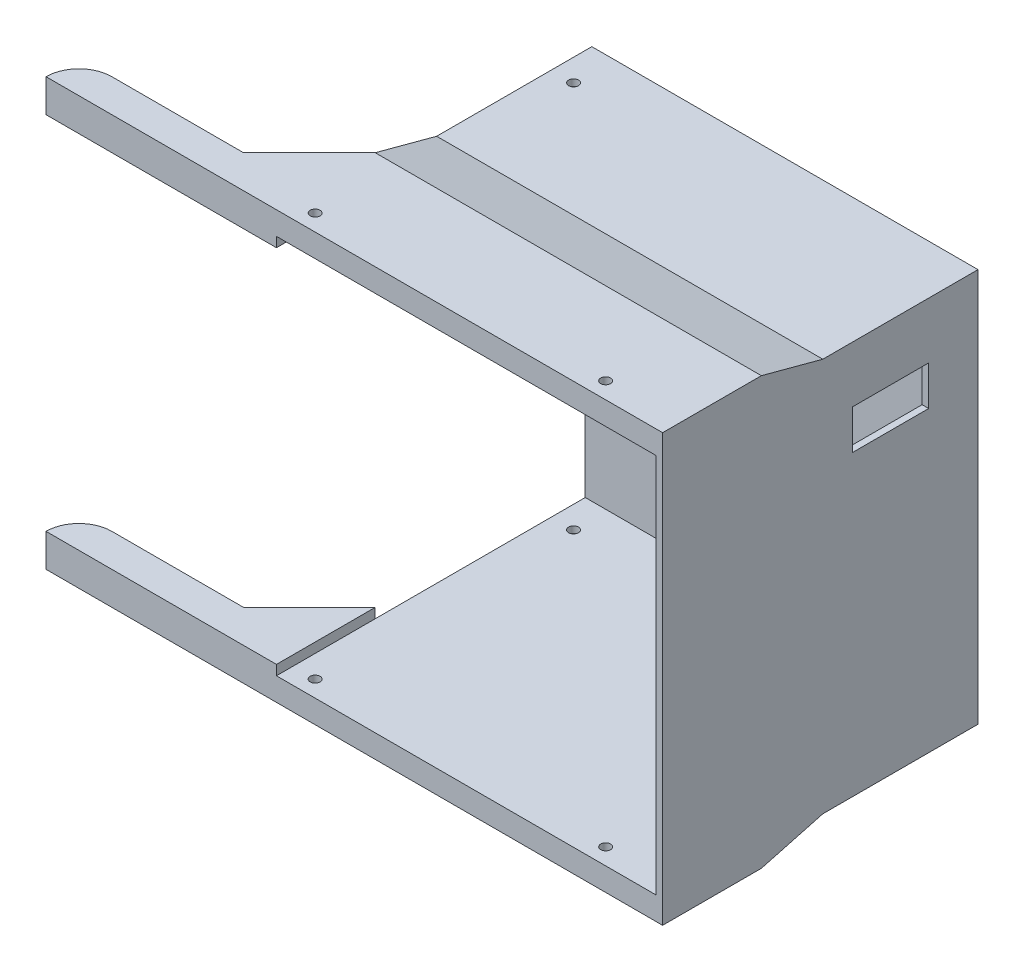
from build123d import *

# Parameters (mm, degrees)
BOSS_EXTRUDE1_DEPTH     = 93.8
SKETCH2_W               = 117.3
SKETCH2_H               = 119.6
SKETCH2_R               = 1.5
BOSS_EXTRUDE2_DEPTH     = 2
SKETCH5_W               = 70
SKETCH5_H               = 10
BOSS_EXTRUDE3_DEPTH     = 5
BOSS_EXTRUDE4_DEPTH     = 5
CHAMFER1_SIZE           = 20
BOSS_EXTRUDE5_DEPTH     = 3
CHAMFER2_SIZE2          = 18.660254038
CHAMFER2_SIZE           = 5
FILLET1_R               = 10
SKETCH4_W               = 23.144126226
SKETCH4_H               = 12
CUT_EXTRUDE2_DEPTH      = 221.131710573
CUT_EXTRUDE1_DEPTH      = 192.840558798
CUT_EXTRUDE1_DEPTH_BACK = 192.840558798
SKETCH3_R               = 1.5


with BuildPart() as part:
    # Sketch1 → Boss-Extrude1 (new body)
    with BuildSketch(Plane.XY):
        Polygon((-40, -57.8), (75.3, -57.8), (75.3, 57.8), (-40, 57.8), (-40, 59.8), (77.3, 59.8), (77.3, -59.8), (-40, -59.8), align=None)
    extrude(amount=-BOSS_EXTRUDE1_DEPTH)

    # Sketch2 → Boss-Extrude2 (add)
    with BuildSketch(Plane(origin=(0, 0, -93.8), x_dir=(-1, 0, 0), z_dir=(0, 0, -1))):
        with Locations((-18.65, 0)):
            Rectangle(SKETCH2_W, SKETCH2_H)
        with Locations(Location((33.25, -19.166666667, 0), (0, 0, 90))):
            Circle(SKETCH2_R, mode=Mode.SUBTRACT)
        with Locations(Location((33.25, 19.166666667, 0), (0, 0, 90))):
            Circle(SKETCH2_R, mode=Mode.SUBTRACT)
    extrude(amount=BOSS_EXTRUDE2_DEPTH)

    # Sketch5 → Boss-Extrude3 (add)
    with BuildSketch(Plane(origin=(0, 59.8, 0), x_dir=(1, 0, 0), z_dir=(0, 1, 0))):
        with Locations((-75, 5)):
            Rectangle(SKETCH5_W, SKETCH5_H)
    extrude(amount=-BOSS_EXTRUDE3_DEPTH)

    # Sketch6 → Boss-Extrude4 (add)
    with BuildSketch(Plane(origin=(0, 59.8, 0), x_dir=(1, 0, 0), z_dir=(0, 1, 0))):
        Polygon((-110, 10), (-40, 10), (-40, 30), (77.3, 30), (77.3, 0), (0, 0), (-110, 0), align=None)
    extrude(amount=BOSS_EXTRUDE4_DEPTH)

    # Chamfer1
    chamfer1_edges = [part.edges().sort_by_distance(p)[0] for p in [
        (-40, 61.3, -10),
    ]]
    chamfer(chamfer1_edges, length=CHAMFER1_SIZE)

    # Sketch7 → Boss-Extrude5 (add)
    with BuildSketch(Plane.XZ.offset(-57.8)):
        Polygon((-60, -10), (-40, -30), (-40, -10), align=None)
    extrude(amount=BOSS_EXTRUDE5_DEPTH)

    # Chamfer2
    chamfer2_edges = [part.edges().sort_by_distance(p)[0] for p in [
        (18.65, 59.8, -30),
    ]]
    chamfer2_side = [part.faces().sort_by_distance(p)[0] for p in [
        (18.65, 59.9, -30),
    ]]
    chamfer(chamfer2_edges, length=CHAMFER2_SIZE - 0.0001, length2=CHAMFER2_SIZE2 - 0.0001, reference=chamfer2_side[0])  # a hair under: the kernel refuses the full size

    # Fillet1
    fillet1_edges = [part.edges().sort_by_distance(p)[0] for p in [
        (-110, 59.8, -10),
    ]]
    fillet(fillet1_edges, radius=FILLET1_R - 0.0001)  # a hair under: the kernel refuses the full size

    # Mirror5: part across plane


with BuildPart() as part_1:
    add(part.part)
    add(part.part.mirror(Plane.ZX))

    # Sketch4 → Cut-Extrude2 (cut, through all)
    with BuildSketch(Plane(origin=(77.3, 0, 0), x_dir=(0, 0, -1), z_dir=(1, 0, 0))):
        with Locations((69.25, 36.75)):
            Rectangle(SKETCH4_W, SKETCH4_H)
    extrude(amount=-CUT_EXTRUDE2_DEPTH, mode=Mode.SUBTRACT)

    # Sketch3 → Cut-Extrude1 (cut, two sides: drawn at the far end of the back side and taken through both)
    with BuildSketch(Plane(origin=(0, 59.8, 0), x_dir=(1, 0, 0), z_dir=(0, 1, 0)).offset(-CUT_EXTRUDE1_DEPTH_BACK)):
        with Locations(Location((55, 5, 0), (0, 0, 180))):
            Circle(SKETCH3_R)
        with Locations(Location((-33.25, 5, 0), (0, 0, 180))):
            Circle(SKETCH3_R)
        with Locations(Location((-33.25, 83.5, 0), (0, 0, 270))):
            Circle(SKETCH3_R)
    extrude(amount=CUT_EXTRUDE1_DEPTH + CUT_EXTRUDE1_DEPTH_BACK, mode=Mode.SUBTRACT)


solid = part_1.part
